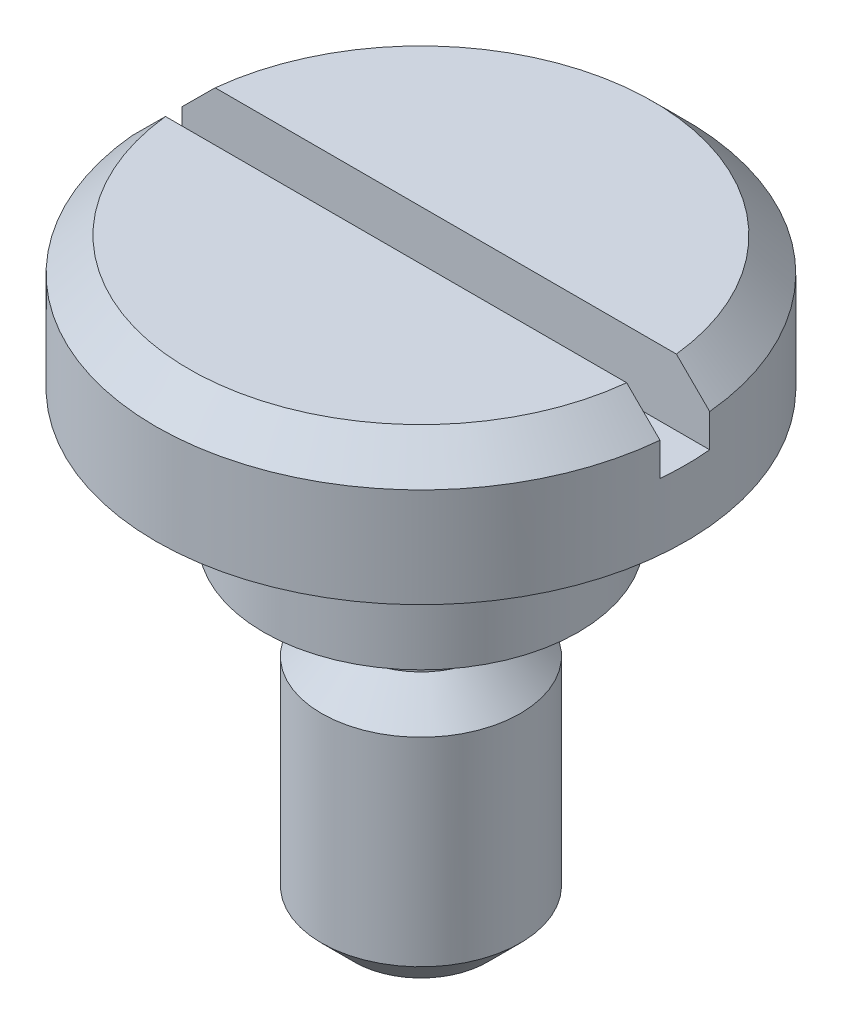
from build123d import *

# Parameters (mm, degrees)
CHAMFER_2_SIZE      = 1
CUT_EXTRUDE_1_DEPTH = 2


with BuildPart() as part:
    # 草图1 → 旋转1 (revolve)
    with BuildSketch(Plane.XY, mode=Mode.PRIVATE) as revolve_1_sk:
        Polygon((0, 0), (3, 0), (3, 8), (2, 8), (2, 10), (4.75, 10), (4.75, 14), (8, 14), (8, 18), (0, 18), align=None)
    revolve(revolve_1_sk.sketch.rotate(Axis((0, 18, 0), (0, -1, 0)), 90), axis=Axis((0, 18, 0), (0, -1, 0)))

    # 倒角2
    chamfer_2_edges = [part.edges().sort_by_distance(p)[0] for p in [
        (0, 8, -3),
        (0, 0, -3),
        (0, 18, -8),
    ]]
    chamfer(chamfer_2_edges, length=CHAMFER_2_SIZE - 0.0001)  # a hair under: the kernel refuses the full size

    # 草图2 → 切除-拉伸1 (cut)
    with BuildSketch(Plane(origin=(0, 18, 0), x_dir=(1, 0, 0), z_dir=(0, 1, 0))):
        with BuildLine():
            Line((-7.964766161, -0.75), (7.964766161, -0.75))
            ThreePointArc((7.964766161, -0.75), (8, 0), (7.964766161, 0.75))
            Line((7.964766161, 0.75), (-7.964766161, 0.75))
            ThreePointArc((-7.964766161, 0.75), (-8, 0), (-7.964766161, -0.75))
        make_face()
    extrude(amount=-CUT_EXTRUDE_1_DEPTH, mode=Mode.SUBTRACT)


solid = part.part
